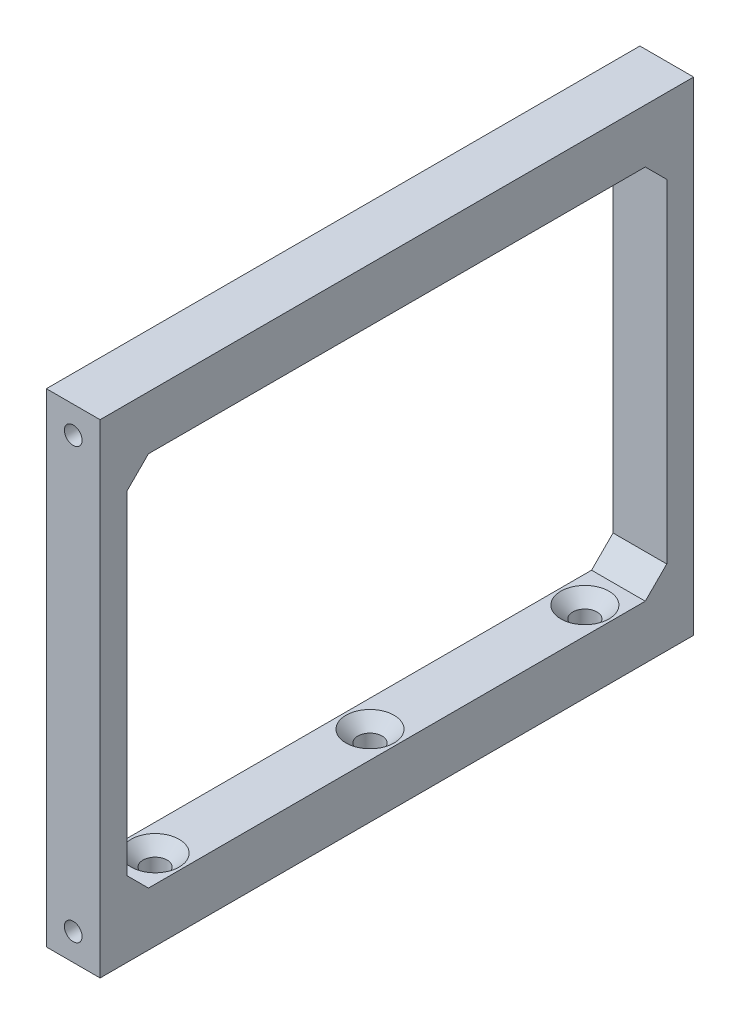
from build123d import *

# Parameters (mm, degrees)
SKETCH1_W                      = 110.48
SKETCH1_H                      = 90
SKETCH1_W_2                    = 100.48
SKETCH1_H_2                    = 70
BOSS_EXTRUDE1_DEPTH            = 10
M4X0_7_TAPPED_HOLE1_AT_2_COUNT = 2
M4X0_7_TAPPED_HOLE1_AT_2_PITCH = 80
CSK_FOR_M4_SFHCS1_D            = 4.5
CSK_FOR_M4_SFHCS1_DEPTH        = 12
CSK_FOR_M4_SFHCS1_CSINK_D      = 8.96
CSK_FOR_M4_SFHCS1_CSINK_ANGLE  = 90
CSK_FOR_M4_SFHCS1_TIP          = 1.351936393
CHAMFER1_SIZE                  = 4


with BuildPart() as part:
    # Sketch1 → Boss-Extrude1 (new body)
    with BuildSketch(Plane(origin=(0, 0, 0), x_dir=(0, 0, -1), z_dir=(1, 0, 0))):
        Rectangle(SKETCH1_W, SKETCH1_H)
        Rectangle(SKETCH1_W_2, SKETCH1_H_2, mode=Mode.SUBTRACT)
    extrude(amount=BOSS_EXTRUDE1_DEPTH)

    # Sketch3 → M4x0.7 Tapped Hole1 (revolve, cut)
    with BuildSketch(Plane(origin=(5, 40, 55.24), x_dir=(0, -1, 0), z_dir=(1, 0, 0))):
        Polygon((0, 0), (0, 12.991420021), (1.65, 12), (1.65, 0), align=None)
    m4x0_7_tapped_hole1 = revolve(axis=Axis((5, 40, 61.59), (0, 0, -1)), mode=Mode.SUBTRACT)

    # M4x0.7 Tapped Hole1 at 2: M4x0.7 Tapped Hole1 ×2
    with Locations(*[(0, -i * M4X0_7_TAPPED_HOLE1_AT_2_PITCH, 0) for i in range(1, M4X0_7_TAPPED_HOLE1_AT_2_COUNT)]):
        add(m4x0_7_tapped_hole1, mode=Mode.SUBTRACT)

    # CSK for M4 SFHCS1
    with Locations(Plane(origin=(0, -35, 0), x_dir=(1, 0, 0), z_dir=(0, 1, 0))):
        with Locations((5, -40), (5, 0), (5, 40)):
            CounterSinkHole(CSK_FOR_M4_SFHCS1_D / 2, CSK_FOR_M4_SFHCS1_CSINK_D / 2, depth=CSK_FOR_M4_SFHCS1_DEPTH, counter_sink_angle=CSK_FOR_M4_SFHCS1_CSINK_ANGLE)
            with Locations((0, 0, -(CSK_FOR_M4_SFHCS1_DEPTH + CSK_FOR_M4_SFHCS1_TIP / 2))):  # 118° drill point
                Cone(0, CSK_FOR_M4_SFHCS1_D / 2, CSK_FOR_M4_SFHCS1_TIP, mode=Mode.SUBTRACT)

    # Mirror1: M4x0.7 Tapped Hole1 across plane
    add(m4x0_7_tapped_hole1.mirror(Plane.XY), mode=Mode.SUBTRACT)

    # Mirror1 copy 1 sketch → Mirror1 copy 1 (revolve, cut)
    with BuildSketch(Plane(origin=(5, -40, -55.24), x_dir=(0, -1, 0), z_dir=(1, 0, 0))):
        Polygon((0, 0), (0, -12.991420021), (1.65, -12), (1.65, 0), align=None)
    revolve(axis=Axis((5, -40, -61.59), (0, 0, -1)), mode=Mode.SUBTRACT)

    # Chamfer1
    chamfer1_edges = [part.edges().sort_by_distance(p)[0] for p in [
        (5, -35, -50.24),
        (5, 35, -50.24),
        (5, 35, 50.24),
        (5, -35, 50.24),
    ]]
    chamfer(chamfer1_edges, length=CHAMFER1_SIZE)


solid = part.part
